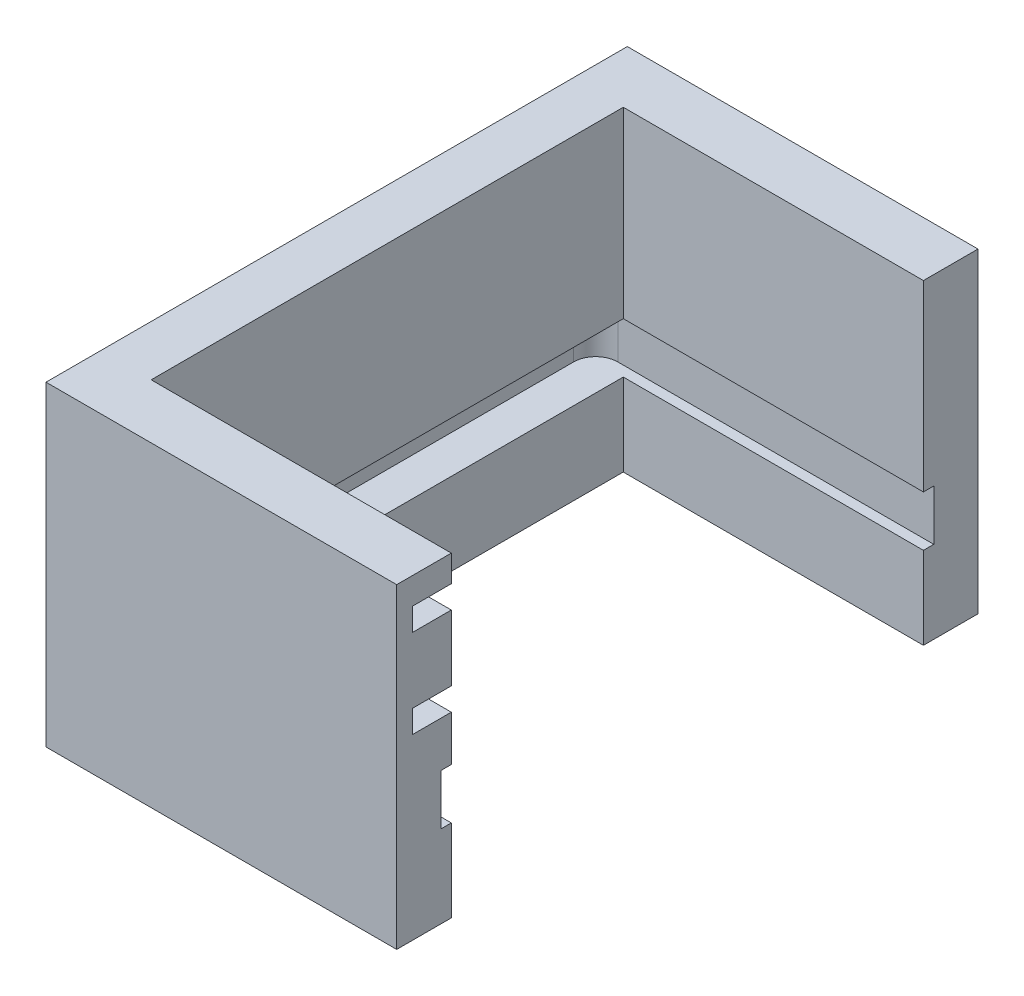
from build123d import *

# Parameters (mm, degrees)
SKETCH1_W           = 4
SKETCH1_H           = 25
BOSS_EXTRUDE1_DEPTH = 46
BOSS_EXTRUDE2_START = -25
BOSS_EXTRUDE2_DEPTH = 25
CAVITY2_START       = 6.511576254
CAVITY2_DEPTH       = 4
CUT_EXTRUDE6_START  = -25
SKETCH8_W           = 23.75
SKETCH8_H           = 0.48
CUT_EXTRUDE6_DEPTH  = 25
SKETCH10_W          = 0.5
SKETCH10_H          = 4
CUT_EXTRUDE8_DEPTH  = 25
CUT_EXTRUDE9_DEPTH  = 4.322904331
BOSS_EXTRUDE4_DEPTH = 1.25
SKETCH13_W          = 0.15
SKETCH13_H          = 0.85
CUT_EXTRUDE10_DEPTH = 3.072904331
LPATTERN4_COUNT     = 2
LPATTERN4_PITCH     = 7


# Read off the part's stored shape, not the designer's step: Cavity2
with BuildPart() as part:
    # Sketch1 → Boss-Extrude1 (new body)
    with BuildSketch(Plane.XY):
        with Locations((2, 12.5)):
            Rectangle(SKETCH1_W, SKETCH1_H)
    extrude(amount=BOSS_EXTRUDE1_DEPTH)

    # Sketch2 → Boss-Extrude2 (add)
    with BuildSketch(Plane(origin=(0, 25, 0), x_dir=(1, 0, 0), z_dir=(0, 1, 0)).offset(BOSS_EXTRUDE2_START)):
        Polygon((27.75, -3.5), (27.75, -4.318971826), (4, -4.318971826), (4, -3.5), (4, 0), (27.75, 0), align=None)
        Polygon((4, -46), (27.75, -46), (27.75, -42), (27.75, -41.197095669), (4, -41.197095669), (4, -42), align=None)
    extrude(amount=BOSS_EXTRUDE2_DEPTH)

    # Cavity2 outline → Cavity2 (cut)
    with BuildSketch(Plane(origin=(0, 0, 0), x_dir=(1, 0, 0), z_dir=(0, 1, 0)).offset(CAVITY2_START)):
        with BuildLine():
            Line((1, -5.25), (1, -40.25))
            ThreePointArc((1, -40.25), (1.512563133, -41.487436867), (2.75, -42))
            Line((2.75, -42), (27.75, -42))
            Line((27.75, -42), (27.75, -41.197095669))
            Line((27.75, -41.197095669), (4, -41.197095669))
            Line((4, -41.197095669), (4, -4.318971826))
            Line((4, -4.318971826), (27.75, -4.318971826))
            Line((27.75, -4.318971826), (27.75, -3.5))
            Line((27.75, -3.5), (2.75, -3.5))
            ThreePointArc((2.75, -3.5), (1.512563133, -4.012563133), (1, -5.25))
        make_face()
    extrude(amount=CAVITY2_DEPTH, mode=Mode.SUBTRACT)

    # Sketch8 → Cut-Extrude6 (cut)
    with BuildSketch(Plane(origin=(0, 25, 0), x_dir=(1, 0, 0), z_dir=(0, 1, 0)).offset(CUT_EXTRUDE6_START)):
        with Locations((15.875, -41.437095669)):
            Rectangle(SKETCH8_W, SKETCH8_H)
    extrude(amount=CUT_EXTRUDE6_DEPTH, mode=Mode.SUBTRACT)

    # Sketch10 → Cut-Extrude8 (cut)
    with BuildSketch(Plane(origin=(27.75, 0, 0), x_dir=(0, 0, -1), z_dir=(1, 0, 0))):
        with Locations((-42.25, 8.511576254)):
            Rectangle(SKETCH10_W, SKETCH10_H)
    extrude(amount=-CUT_EXTRUDE8_DEPTH, mode=Mode.SUBTRACT)

    # Sketch11 → Cut-Extrude9 (cut)
    with BuildSketch(Plane.XY.offset(46)):
        Polygon((22, 22.9), (22, 21.1), (23.86, 20.25), (24.31, 20.25), (24.31, 21.1), (27.75, 21.1), (27.75, 22.9), (24.352614362, 22.9), align=None)
    cut_extrude9 = extrude(amount=-CUT_EXTRUDE9_DEPTH, mode=Mode.SUBTRACT)

    # Sketch12 → Boss-Extrude4 (add)
    with BuildSketch(Plane.XY.offset(46)):
        Polygon((27.75, 21.1), (27.75, 22.9), (22, 22.9), (22, 21.1), (23.86, 20.25), (24.31, 20.25), (24.31, 21.1), align=None)
    boss_extrude4 = extrude(amount=-BOSS_EXTRUDE4_DEPTH)

    # Sketch13 → Cut-Extrude10 (cut)
    with BuildSketch(Plane(origin=(0, 0, 41.677095669), x_dir=(-1, 0, 0), z_dir=(0, 0, -1))):
        with Locations((-24.385, 20.675)):
            Rectangle(SKETCH13_W, SKETCH13_H)
    cut_extrude10 = extrude(amount=-CUT_EXTRUDE10_DEPTH, mode=Mode.SUBTRACT)

    # LPattern4: Cut-Extrude9, Boss-Extrude4, Cut-Extrude10 ×2
    with Locations(*[(0, -i * LPATTERN4_PITCH, 0) for i in range(1, LPATTERN4_COUNT)]):
        add(cut_extrude9, mode=Mode.SUBTRACT)
        add(boss_extrude4)
        add(cut_extrude10, mode=Mode.SUBTRACT)


solid = part.part
